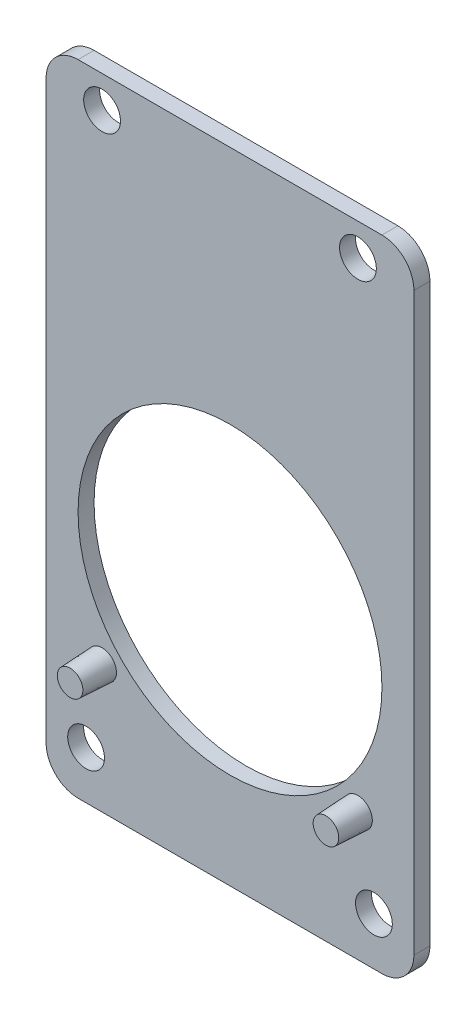
from build123d import *

# Parameters (mm, degrees)
SKETCH_1_W          = 23
SKETCH_1_H          = 40
SKETCH_1_R          = 9.5
EXTRUDE_1_DEPTH     = 1
FILLET_1_R          = 2
SKETCH_3_R          = 1.15
CUT_EXTRUDE_1_DEPTH = 24.092206478
SKETCH_4_R          = 0.9
EXTRUDE_2_DEPTH     = 2
CHAMFER_1_SIZE      = 2
CHAMFER_1_SIZE_2    = 0.1


with BuildPart() as part:
    # 草图1 → 凸台-拉伸1 (new body)
    with BuildSketch(Plane.XY):
        Rectangle(SKETCH_1_W, SKETCH_1_H)
        with Locations((0, -4.5)):
            Circle(SKETCH_1_R, mode=Mode.SUBTRACT)
    extrude(amount=EXTRUDE_1_DEPTH)

    # 圆角1
    fillet_1_edges = [part.edges().sort_by_distance(p)[0] for p in [
        (11.5, -20, 0.5),
        (-11.5, -20, 0.5),
        (-11.5, 20, 0.5),
        (11.5, 20, 0.5),
    ]]
    fillet(fillet_1_edges, radius=FILLET_1_R)

    # 草图3 → 切除-拉伸1 (cut, through all)
    with BuildSketch(Plane.XY.offset(1)):
        with Locations((-8, 18)):
            Circle(SKETCH_3_R)
        with Locations((8, 18)):
            Circle(SKETCH_3_R)
        with Locations((-9, -17)):
            Circle(SKETCH_3_R)
        with Locations((9, -17)):
            Circle(SKETCH_3_R)
    extrude(amount=-CUT_EXTRUDE_1_DEPTH, mode=Mode.SUBTRACT)

    # 草图4 → 凸台-拉伸2 (add)
    with BuildSketch(Plane.XY.offset(1)):
        with Locations(Location((-8, -12, 0), (0, 0, 180))):
            Circle(SKETCH_4_R)
        with Locations(Location((8, -12, 0), (0, 0, 180))):
            Circle(SKETCH_4_R)
    extrude(amount=EXTRUDE_2_DEPTH)

    # 倒角1
    # the kernel refuses this chamfer: 2, 0.1 mm, written as the material it takes off along each edge
    with BuildSketch(Plane(origin=(-8, -12, 3), x_dir=(-1, 0, 0), z_dir=(0, 1, 0))) as chamfer_1_piece_1_section:
        Polygon((0.9, -CHAMFER_1_SIZE), (0.9 - CHAMFER_1_SIZE_2, 0), (0.9, 0), align=None)
    chamfer_1_piece_1 = revolve(axis=Axis((-8, -12, 3), (0, 0, 1)), mode=Mode.PRIVATE)
    chamfer_1_piece_1 = split(chamfer_1_piece_1, bisect_by=Plane(origin=(-7.141866516, -12, 1), z_dir=(0, 0, 1)), keep=Keep.TOP, mode=Mode.PRIVATE)
    add(chamfer_1_piece_1, mode=Mode.SUBTRACT)
    with BuildSketch(Plane(origin=(8, -12, 3), x_dir=(-1, 0, 0), z_dir=(0, 1, 0))) as chamfer_1_piece_2_section:
        Polygon((0.9, -CHAMFER_1_SIZE), (0.9 - CHAMFER_1_SIZE_2, 0), (0.9, 0), align=None)
    chamfer_1_piece_2 = revolve(axis=Axis((8, -12, 3), (0, 0, 1)), mode=Mode.PRIVATE)
    chamfer_1_piece_2 = split(chamfer_1_piece_2, bisect_by=Plane(origin=(8.858133484, -12, 1), z_dir=(0, 0, 1)), keep=Keep.TOP, mode=Mode.PRIVATE)
    add(chamfer_1_piece_2, mode=Mode.SUBTRACT)


solid = part.part
